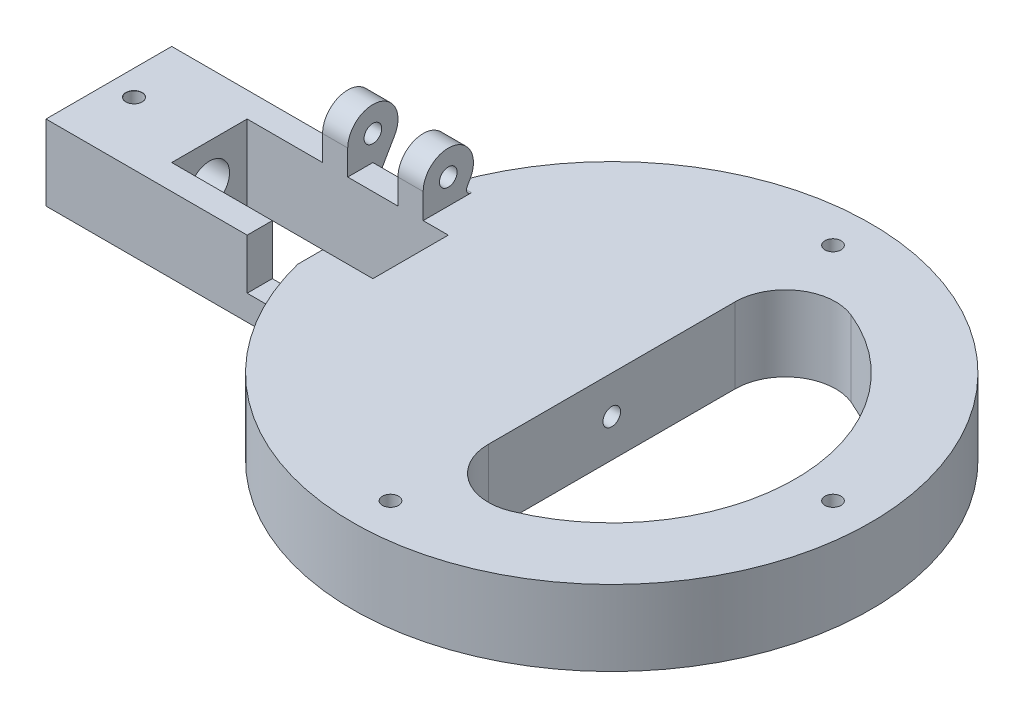
from build123d import *

# Parameters (mm, degrees)
SKETCH2_W                            = 100
SKETCH2_H                            = 25
SKETCH2_W_2                          = 40
SKETCH2_H_2                          = 15
BOSS_EXTRUDE1_DEPTH                  = 15
CUT_EXTRUDE1_REACH                   = 103.888
SKETCH3_R                            = 1.75
CUT_EXTRUDE2_REACH                   = 103.888
SKETCH4_R                            = 4
F_3_2_3_2_DIAMETER_HOLE1_D           = 3.2
F_3_2_3_2_DIAMETER_HOLE1_CSINK_D     = 3.25
F_3_2_3_2_DIAMETER_HOLE1_CSINK_ANGLE = 90
SKETCH9_R                            = 1.75
BOSS_EXTRUDE3_DEPTH                  = 40
SKETCH12_W                           = 15
SKETCH12_H                           = 15
SKETCH12_W_2                         = 10
SKETCH12_W_3                         = 5
CUT_EXTRUDE3_DEPTH                   = 69.007352544
SKETCH11_R                           = 1.6
BOSS_EXTRUDE4_DEPTH                  = 15
FILLET1_R                            = 10
SKETCH13_W                           = 15
SKETCH13_H                           = 2.886751346
SKETCH13_W_2                         = 10
CUT_EXTRUDE4_DEPTH                   = 124.731564295
FILLET3_R                            = 1
SKETCH14_W                           = 10.040016013
SKETCH14_H                           = 5
CUT_EXTRUDE5_DEPTH                   = 10


with BuildPart() as part:
    # Sketch2 → Boss-Extrude1 (new body)
    with BuildSketch(Plane(origin=(0, 0, 0), x_dir=(1, 0, 0), z_dir=(0, 1, 0))):
        with Locations((10, 0)):
            Rectangle(SKETCH2_W, SKETCH2_H)
        Rectangle(SKETCH2_W_2, SKETCH2_H_2, mode=Mode.SUBTRACT)
    extrude(amount=BOSS_EXTRUDE1_DEPTH)

    # Sketch3 → Cut-Extrude1 (cut, up to next)
    with BuildSketch(Plane(origin=(60, 0, 0), x_dir=(0, 0, -1), z_dir=(1, 0, 0)), mode=Mode.PRIVATE) as cut_extrude1_sk1:
        with Locations((0, 7.5)):
            Circle(SKETCH3_R)
    cut_extrude1_tool1 = extrude(cut_extrude1_sk1.sketch, amount=-CUT_EXTRUDE1_REACH, mode=Mode.PRIVATE) & part.part
    add(cut_extrude1_tool1.solids().sort_by_distance((60, 7.5, 0))[0], mode=Mode.SUBTRACT)

    # Sketch4 → Cut-Extrude2 (cut, up to next)
    with BuildSketch(Plane.ZY.offset(40), mode=Mode.PRIVATE) as cut_extrude2_sk1:
        with Locations((0, 7.5)):
            Circle(SKETCH4_R)
    cut_extrude2_tool1 = extrude(cut_extrude2_sk1.sketch, amount=-CUT_EXTRUDE2_REACH, mode=Mode.PRIVATE) & part.part
    add(cut_extrude2_tool1.solids().sort_by_distance((-40, 7.5, 0))[0], mode=Mode.SUBTRACT)

    # Ø3.2 (3.2) Diameter Hole1 (through all)
    with Locations(Plane(origin=(0, 15, 0), x_dir=(1, 0, 0), z_dir=(0, 1, 0))):
        with Locations((-35, 0)):
            CounterSinkHole(F_3_2_3_2_DIAMETER_HOLE1_D / 2, F_3_2_3_2_DIAMETER_HOLE1_CSINK_D / 2, counter_sink_angle=F_3_2_3_2_DIAMETER_HOLE1_CSINK_ANGLE)

    # Sketch9 → Boss-Extrude3 (add)
    with BuildSketch(Plane(origin=(-20, 0, 0), x_dir=(0, 0, -1), z_dir=(1, 0, 0))):
        with BuildLine():
            Line((7.5, 15), (12.5, 15))
            Line((12.5, 15), (12.5, 10))
            Line((12.5, 10), (16.830127019, 17.5))
            ThreePointArc((16.830127019, 17.5), (13.794095226, 24.829629131), (7.5, 20))
            Line((7.5, 20), (7.5, 15))
        make_face()
        with Locations((12.5, 20)):
            Circle(SKETCH9_R, mode=Mode.SUBTRACT)
    extrude(amount=BOSS_EXTRUDE3_DEPTH)

    # Sketch12 → Cut-Extrude3 (cut, through all)
    with BuildSketch(Plane.XY.offset(-7.5)):
        with Locations((-12.5, 22.5)):
            Rectangle(SKETCH12_W, SKETCH12_H)
        with Locations((5, 22.5)):
            Rectangle(SKETCH12_W_2, SKETCH12_H)
        with Locations((17.5, 22.5)):
            Rectangle(SKETCH12_W_3, SKETCH12_H)
    extrude(amount=-CUT_EXTRUDE3_DEPTH, mode=Mode.SUBTRACT)

    # Sketch11 → Boss-Extrude4 (add)
    with BuildSketch(Plane.XZ):
        with BuildLine():
            Line((60, 12.5), (60, 36.5))
            ThreePointArc((60, 36.5), (96.5, 0), (60, -36.5))
            Line((60, -36.5), (60, -12.5))
            Line((60, -12.5), (10.040016013, -12.5))
            ThreePointArc((10.040016013, -12.5), (111.5, 0), (10.040016013, 12.5))
            Line((10.040016013, 12.5), (60, 12.5))
        make_face()
        with Locations((60, 44)):
            Circle(SKETCH11_R, mode=Mode.SUBTRACT)
        with Locations((60, -44)):
            Circle(SKETCH11_R, mode=Mode.SUBTRACT)
        with Locations((104, 0)):
            Circle(SKETCH11_R, mode=Mode.SUBTRACT)
    extrude(amount=-BOSS_EXTRUDE4_DEPTH)

    # Fillet1
    fillet1_edges = [part.edges().sort_by_distance(p)[0] for p in [
        (60, 7.5, 36.5),
        (60, 7.5, -36.5),
    ]]
    fillet(fillet1_edges, radius=FILLET1_R)

    # Sketch13 → Cut-Extrude4 (cut, through all)
    with BuildSketch(Plane(origin=(0, 15, 0), x_dir=(1, 0, 0), z_dir=(0, 1, 0))):
        with Locations((-12.5, 13.943375673)):
            Rectangle(SKETCH13_W, SKETCH13_H)
        with Locations((5, 13.943375673)):
            Rectangle(SKETCH13_W_2, SKETCH13_H)
    extrude(amount=-CUT_EXTRUDE4_DEPTH, mode=Mode.SUBTRACT)

    # Fillet3
    fillet3_edges = [part.edges().sort_by_distance(p)[0] for p in [
        (-2.5, 10, -12.5),
        (12.926142534, 15, -15.386751346),
    ]]
    fillet(fillet3_edges, radius=FILLET3_R)

    # Sketch14 → Cut-Extrude5 (cut)
    with BuildSketch(Plane(origin=(0, 15, 0), x_dir=(1, 0, 0), z_dir=(0, 1, 0))):
        with Locations((5.020008007, -10)):
            Rectangle(SKETCH14_W, SKETCH14_H)
    extrude(amount=-CUT_EXTRUDE5_DEPTH, mode=Mode.SUBTRACT)


solid = part.part
